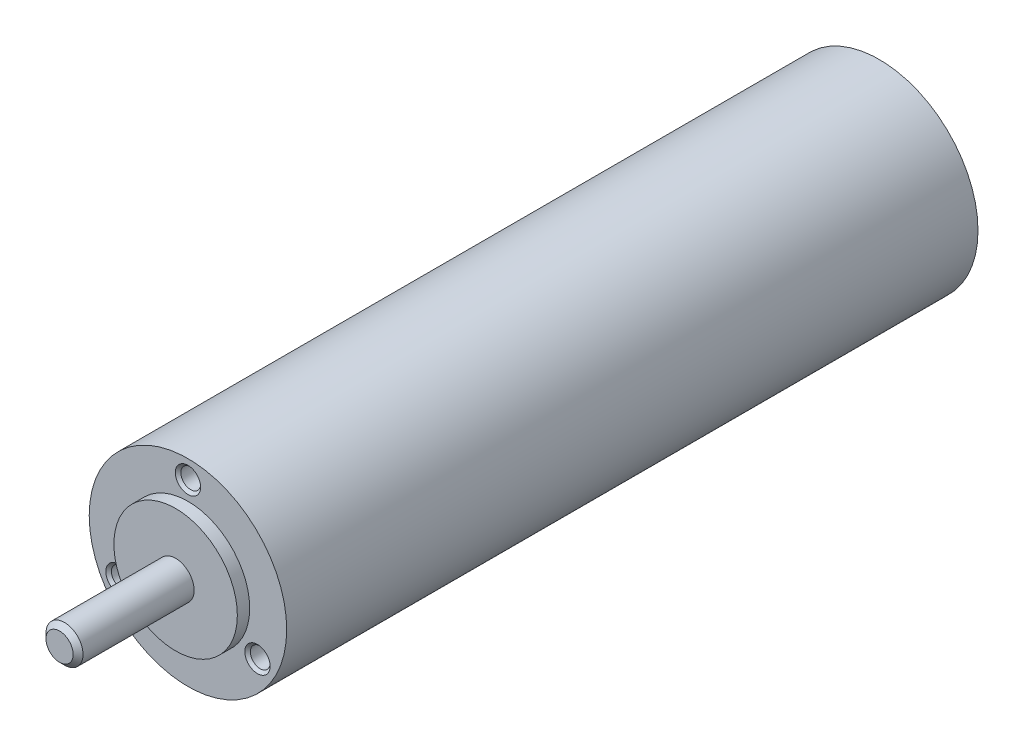
from build123d import *

# Parameters (mm, degrees)
CHAMFER_1_SIZE           = 0.4
PATTERN_CIRCULAR_1_COUNT = 3


with BuildPart() as part:
    # Эскиз1 → Повернуть1 (revolve)
    with BuildSketch(Plane(origin=(0, 0, 0), x_dir=(0, 0, -1), z_dir=(1, 0, 0))):
        Polygon((0, 0), (0, -1.5), (9.4, -1.5), (9.4, -5), (10.4, -5), (10.4, -8), (66.4, -8), (66.4, 0), align=None)
    revolve(axis=Axis((0, 0, 0), (0, 0, -1)))

    # Фаска1
    chamfer_1_edges = [part.edges().sort_by_distance(p)[0] for p in [
        (0, 1.5, 0),
    ]]
    chamfer(chamfer_1_edges, length=CHAMFER_1_SIZE)

    # Эскиз5 → Отверстие обработанное метчиком M2x0.41 (revolve, cut)
    with BuildSketch(Plane(origin=(0, 6.5, -10.4), x_dir=(0, -1, 0), z_dir=(1, 0, 0))):
        Polygon((0, 0), (0, 4.480688495), (0.8, 4), (0.8, 0.225), (1.025, 0), align=None)
    m2x0_41 = revolve(axis=Axis((0, 6.5, -4.05), (0, 0, -1)), mode=Mode.SUBTRACT)

    # Круговой массив1: Отверстие обработанное метчиком M2x0.41 ×3 about axis
    pattern_circular_1_axis = Axis((0, 0, 0), (0, 0, 1))
    for i in range(1, PATTERN_CIRCULAR_1_COUNT):
        add(m2x0_41.rotate(pattern_circular_1_axis, i * 360 / PATTERN_CIRCULAR_1_COUNT), mode=Mode.SUBTRACT)


solid = part.part
